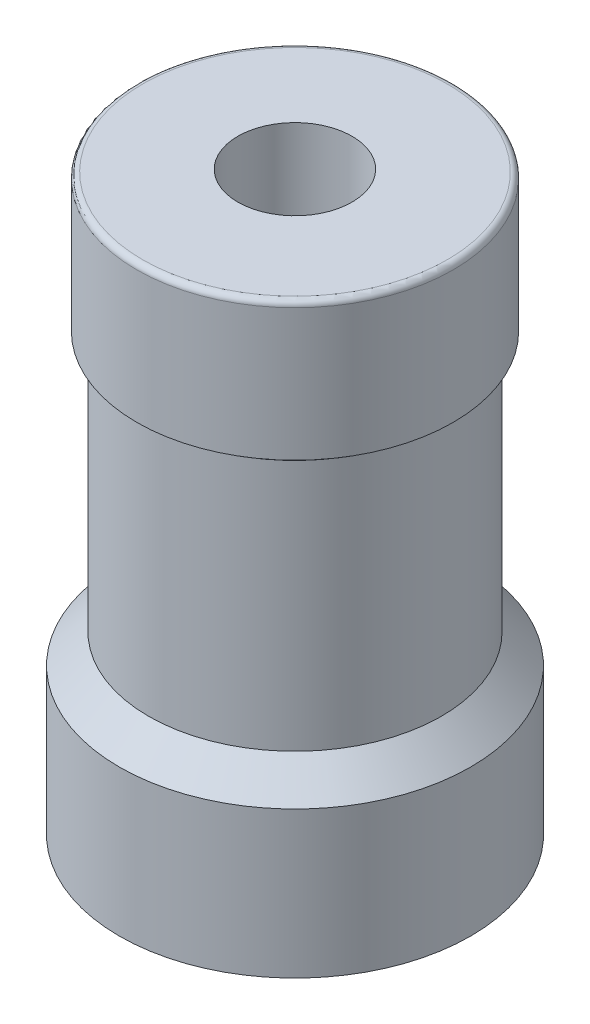
from build123d import *

# Parameters (mm, degrees)
M20X0_5_TAPPED_HOLE1_D     = 19.5
M20X0_5_TAPPED_HOLE1_DEPTH = 54
M20X0_5_TAPPED_HOLE1_TIP   = 5.858391036
CHAMFER1_SIZE              = 5
FILLET3_R                  = 1
CIRPATTERN1_COUNT          = 3


with BuildPart() as part:
    # Sketch1 → Revolve1 (revolve)
    with BuildSketch(Plane(origin=(0, 0, 0), x_dir=(0, 0, -1), z_dir=(1, 0, 0))):
        Polygon((0, 0), (-30, 0), (-30, 30), (-25, 30), (-25, 73), (-27, 74.450346012), (-27, 98), (0, 98), align=None)
    revolve(axis=Axis((0, 214.375507313, 0), (0, -1, 0)))

    # M20x0.5 Tapped Hole1
    with Locations(Plane(origin=(-0.400317765, 98, -0.390314584), x_dir=(0, 0, 1), z_dir=(0, 1, 0))):
        with Locations((0, 0)):
            Hole(M20X0_5_TAPPED_HOLE1_D / 2, depth=M20X0_5_TAPPED_HOLE1_DEPTH)
            with Locations((0, 0, -(M20X0_5_TAPPED_HOLE1_DEPTH + M20X0_5_TAPPED_HOLE1_TIP / 2))):  # 118° drill point
                Cone(0, M20X0_5_TAPPED_HOLE1_D / 2, M20X0_5_TAPPED_HOLE1_TIP, mode=Mode.SUBTRACT)

    # Chamfer1
    chamfer1_edges = [part.edges().sort_by_distance(p)[0] for p in [
        (0, 30, -30),
    ]]
    chamfer(chamfer1_edges, length=CHAMFER1_SIZE - 0.0001)  # a hair under: the kernel refuses the full size

    # Fillet3
    fillet3_edges = [part.edges().sort_by_distance(p)[0] for p in [
        (0, 98, -27),
    ]]
    fillet(fillet3_edges, radius=FILLET3_R)

    # Sketch4 → M6x0.5 Tapped Hole1 (revolve, cut)
    with BuildSketch(Plane(origin=(-0.125783676, 0, 19.999604458), x_dir=(0, 0, -1), z_dir=(1, 0, 0))):
        Polygon((0, 0), (0, 26.652366702), (2.75, 25), (2.75, 0), align=None)
    m6x0_5_tapped_hole1 = revolve(axis=Axis((-0.125783676, -6.35, 19.999604458), (0, 1, 0)), mode=Mode.SUBTRACT)

    # CirPattern1: M6x0.5 Tapped Hole1 ×3 about axis
    cirpattern1_axis = Axis((0.001065889, 0, -0.169476304), (0, 1, 0))
    for i in range(1, CIRPATTERN1_COUNT):
        add(m6x0_5_tapped_hole1.rotate(cirpattern1_axis, i * 360 / CIRPATTERN1_COUNT), mode=Mode.SUBTRACT)


solid = part.part
